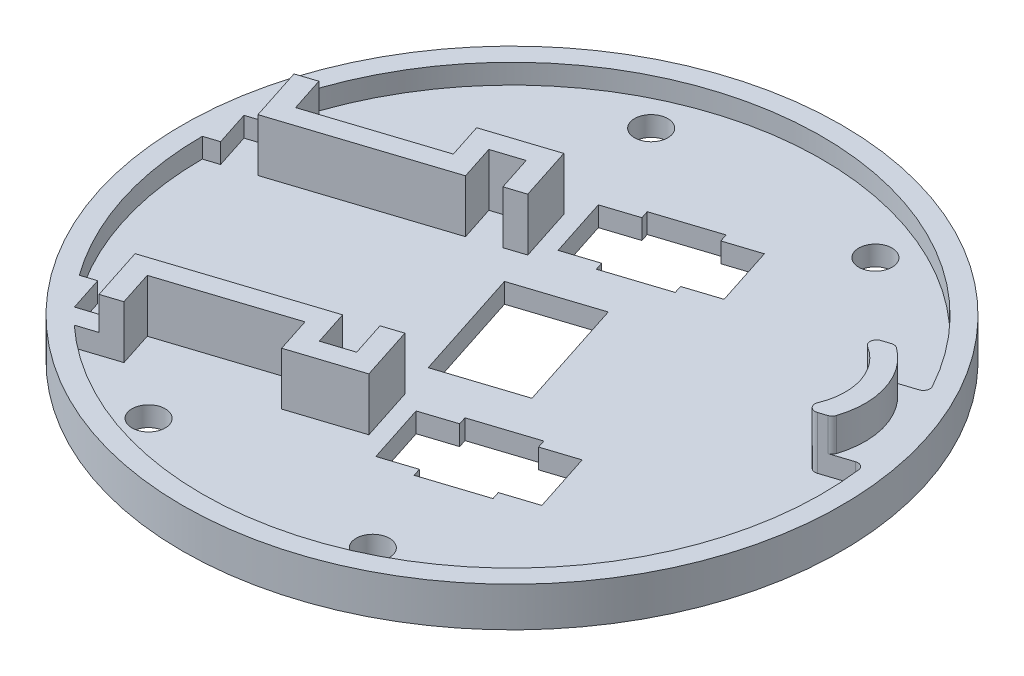
from build123d import *

# Parameters (mm, degrees)
A_BASE_T_START                 = -1.5
A_BASE_T_OUTLINE_R             = 47
A_BASE_T_OUTLINE_R_2           = 1
A_BASE_T_DEPTH                 = 3
OUTER_RING_DEPTH               = 3
OUTER_RING_DEPTH_BACK          = 3
SKETCH1_R                      = 50
SKETCH1_R_2                    = 47.000000000000014
SERVO_FRAME_DEPTH              = 3
PATCHING_START                 = -3
SKETCH4_R                      = 1.000000000000005
SKETCH4_R_2                    = 0.9999999999999875
SKETCH4_R_3                    = 1.0000000000000018
PATCHING_DEPTH                 = 3
BOTTOM_HOLES_DEPTH             = 71.77428911688199
SERVO_FRAME_EXTENSION_DEPTH    = 5
F_8_0_199_DIAMETER_HOLE1_D     = 5.0546
F_8_0_199_DIAMETER_HOLE1_DEPTH = 10
F_8_0_199_DIAMETER_HOLE1_TIP   = 1.5185550424683532
SHELL_TAB_DEPTH                = 3
SHELL_TAB_EXTENSION_DEPTH      = 5
CONTOURING_R                   = 1


# Read off the part's stored shape, not the designer's step: a_base_t
with BuildPart() as part:
    # a_base_t outline → a_base_t (new body)
    with BuildSketch(Plane(origin=(0, 0, 0), x_dir=(1, 0, 0), z_dir=(0, 1, 0)).offset(A_BASE_T_START)):
        Circle(A_BASE_T_OUTLINE_R)
        with Locations((-17.009259258, -38.128042167)):
            Circle(A_BASE_T_OUTLINE_R_2, mode=Mode.SUBTRACT)
        with Locations((-9.166666665, -28.284271247)):
            Circle(A_BASE_T_OUTLINE_R_2, mode=Mode.SUBTRACT)
        with Locations((17.009259258, -38.128042167)):
            Circle(A_BASE_T_OUTLINE_R_2, mode=Mode.SUBTRACT)
        with Locations((27.5, -28.284271247)):
            Circle(A_BASE_T_OUTLINE_R_2, mode=Mode.SUBTRACT)
        with Locations((-27.5, 28.284271247)):
            Circle(A_BASE_T_OUTLINE_R_2, mode=Mode.SUBTRACT)
        with Locations((-17.009259258, 38.128042167)):
            Circle(A_BASE_T_OUTLINE_R_2, mode=Mode.SUBTRACT)
        with Locations((9.166666665, 28.284271247)):
            Circle(A_BASE_T_OUTLINE_R_2, mode=Mode.SUBTRACT)
        with Locations((17.009259258, 38.128042167)):
            Circle(A_BASE_T_OUTLINE_R_2, mode=Mode.SUBTRACT)
    extrude(amount=A_BASE_T_DEPTH)

    # Sketch1 → Outer Ring (add, two sides: drawn at the far end of the back side and taken through both)
    with BuildSketch(Plane(origin=(0, 1.5, 0), x_dir=(1, 0, 0), z_dir=(0, 1, 0)).offset(-OUTER_RING_DEPTH_BACK)):
        with Locations(Location((0, 0, 0), (0, 0, 270))):
            Circle(SKETCH1_R)
        with Locations(Location((0, 0, 0), (0, 0, 270))):
            Circle(SKETCH1_R_2, mode=Mode.SUBTRACT)
    extrude(amount=OUTER_RING_DEPTH + OUTER_RING_DEPTH_BACK)

    # Sketch2 → Servo Frame (add)
    with BuildSketch(Plane(origin=(0, 1.5, 0), x_dir=(1, 0, 0), z_dir=(0, 1, 0))):
        with BuildLine():
            Line((-38.0591968031926, -27.57711984047382), (-35.959340758040334, -26.89657621793413))
            Line((-35.959340758040334, -26.89657621793413), (-34.26367139752046, -32.128660450798996))
            Line((-34.26367139752046, -32.128660450798996), (-29.982875206994592, -30.74129461037364))
            Line((-29.982875206994592, -30.74129461037364), (-31.678544567514475, -25.509210377508683))
            Line((-31.678544567514475, -25.509210377508683), (-7.896343509037404, -17.801622375145534))
            Line((-7.896343509037404, -17.801622375145534), (-6.200674148517496, -23.033706608010526))
            Line((-6.200674148517496, -23.033706608010526), (-1.9198779579916272, -21.64634076758515))
            Line((-1.9198779579916272, -21.64634076758515), (-3.6155473185115334, -16.414256534720167))
            Line((-3.6155473185115334, -16.414256534720167), (-0.7616831914942761, -15.489345974436619))
            Line((-0.7616831914942761, -15.489345974436619), (1.8588967293091871, -23.57529433431882))
            Line((1.8588967293091871, -23.57529433431882), (-8.1296277152512, -26.812481295311326))
            Line((-8.1296277152512, -26.812481295311326), (-9.825297075771067, -21.580397062446362))
            Line((-9.825297075771067, -21.580397062446362), (-27.89976988021365, -27.438163944242362))
            Line((-27.89976988021365, -27.438163944242362), (-26.20410051969376, -32.670248177107304))
            Line((-26.20410051969376, -32.670248177107304), (-31.900225974204588, -34.516308939321476))
            ThreePointArc((-31.900225974204588, -34.516308939321476), (-35.15136263609195, -31.199065768480295), (-38.0591968031926, -27.57711984047382))
        make_face()
        with BuildLine():
            Line((-12.323065195039092, 20.183955613279007), (-22.311589639599458, 16.946768652286423))
            Line((-22.311589639599458, 16.946768652286423), (-20.615920279079525, 11.714684419421493))
            Line((-20.615920279079525, 11.714684419421493), (-38.690393083522096, 5.856917537625489))
            Line((-38.690393083522096, 5.856917537625489), (-40.38606244404183, 11.089001770490507))
            Line((-40.38606244404183, 11.089001770490507), (-46.08218789855281, 9.242941008276162))
            ThreePointArc((-46.08218789855281, 9.242941008276162), (-46.769478259318326, 4.649290628811158), (-46.999998885933856, 0.01023338735953519))
            Line((-46.999998885933856, 0.01023338735953519), (-44.90014284078164, 0.6907770098992967))
            Line((-44.90014284078164, 0.6907770098992967), (-46.595812201301534, 5.922861242764241))
            Line((-46.595812201301534, 5.922861242764241), (-42.31501601077568, 7.31022708318961))
            Line((-42.31501601077568, 7.31022708318961), (-40.61934665025577, 2.0781428503246593))
            Line((-40.61934665025577, 2.0781428503246593), (-16.8371455917787, 9.785730852687836))
            Line((-16.8371455917787, 9.785730852687836), (-18.53281495229861, 15.017815085552826))
            Line((-18.53281495229861, 15.017815085552826), (-14.252018761772744, 16.405180925978193))
            Line((-14.252018761772744, 16.405180925978193), (-12.556349401252827, 11.173096693113212))
            Line((-12.556349401252827, 11.173096693113212), (-9.702485274235583, 12.09800725339679))
            Line((-9.702485274235583, 12.09800725339679), (-12.323065195039092, 20.183955613279007))
        make_face()
    extrude(amount=SERVO_FRAME_DEPTH)

    # Sketch4 → Patching (add)
    with BuildSketch(Plane(origin=(0, 1.5, 0), x_dir=(1, 0, 0), z_dir=(0, 1, 0)).offset(PATCHING_START)):
        with Locations((-9.166666664999994, -28.284271247461895)):
            Circle(SKETCH4_R)
        with Locations((27.499999999999897, -28.284271247461895)):
            Circle(SKETCH4_R_2)
        with Locations((-27.499999999999897, 28.284271247461895)):
            Circle(SKETCH4_R_3)
        with Locations((9.166666664999994, 28.284271247461895)):
            Circle(SKETCH4_R)
    extrude(amount=PATCHING_DEPTH)

    # Sketch3 → Bottom Holes (cut, through all)
    with BuildSketch(Plane(origin=(0, 1.5, 0), x_dir=(1, 0, 0), z_dir=(0, 1, 0))):
        Polygon((-2.4573525520141377, -10.257261741571627), (-8.006815913715702, 6.865923020531821), (3.8842846155226813, 10.719717021713405), (9.43374797722423, -6.403467740390065), align=None)
        Polygon((11.007812758181103, 21.175234550786502), (8.078929317282705, 30.212470953007827), (3.084667095002796, 28.593877472511632), (2.6992876948846334, 29.78298752543549), (-6.337948707336641, 26.854104084537454), (-5.952569307218477, 25.6649940316136), (-10.9468315294987, 24.046400551117266), (-8.017948088600651, 15.009164148896), (-3.023685866320578, 16.62775762939225), (-2.6383064662022653, 15.438647576468425), (6.398929936019005, 18.36753101736646), (6.01355053590084, 19.55664107029031), align=None)
        Polygon((19.270601899965627, -21.348744750290177), (19.65598130008379, -22.53785480321403), (10.618744897862516, -25.46673824411206), (10.233365497744353, -24.27762819118821), (5.239103275464198, -25.89622167168446), (2.3102198345661495, -16.85898526946319), (7.304482056846301, -15.240391788966894), (6.9191026567281435, -14.051281736043038), (15.95633905894941, -11.122398295145004), (16.34171845906757, -12.31150834806886), (21.335980681347763, -10.692914867572457), (24.2648641222456, -19.7301512697939), align=None)
    extrude(amount=-BOTTOM_HOLES_DEPTH, mode=Mode.SUBTRACT)

    # Sketch8 → Servo Frame Extension (add)
    with BuildSketch(Plane(origin=(0, 4.500000000000001, 0), x_dir=(1, 0, 0), z_dir=(0, 1, 0))):
        Polygon((1.8588967293091865, -23.57529433431882), (-0.7616831914942761, -15.489345974436619), (-3.6155473185115334, -16.414256534720167), (-1.9198779579916272, -21.64634076758515), (-6.200674148517496, -23.033706608010526), (-7.896343509037404, -17.801622375145534), (-31.678544567514475, -25.509210377508683), (-29.982875206994592, -30.74129461037364), (-29.057964646711014, -33.59515873739088), (-26.20410051969376, -32.670248177107304), (-27.89976988021365, -27.438163944242362), (-9.825297075771067, -21.580397062446362), (-8.1296277152512, -26.812481295311326), align=None)
        Polygon((-40.38606244404183, 11.089001770490507), (-43.23992657105916, 10.164091210206845), (-42.31501601077568, 7.31022708318961), (-40.61934665025577, 2.0781428503246593), (-16.837145591778697, 9.785730852687836), (-18.53281495229861, 15.017815085552826), (-14.252018761772744, 16.405180925978193), (-12.556349401252827, 11.173096693113212), (-9.702485274235583, 12.09800725339679), (-12.323065195039092, 20.183955613279007), (-22.311589639599458, 16.946768652286423), (-20.615920279079525, 11.714684419421493), (-38.690393083522096, 5.856917537625489), align=None)
    extrude(amount=SERVO_FRAME_EXTENSION_DEPTH)

    # #8 (0.199) Diameter Hole1
    with Locations(Plane(origin=(0, 1.5, 0), x_dir=(1, 0, 0), z_dir=(0, 1, 0))):
        with Locations((17.009259258, -38.128042167), (17.009259258, 38.128042167), (-17.009259258, 38.128042167), (-17.009259258, -38.128042167)):
            Hole(F_8_0_199_DIAMETER_HOLE1_D / 2, depth=F_8_0_199_DIAMETER_HOLE1_DEPTH)
            with Locations((0, 0, -(F_8_0_199_DIAMETER_HOLE1_DEPTH + F_8_0_199_DIAMETER_HOLE1_TIP / 2))):  # 118° drill point
                Cone(0, F_8_0_199_DIAMETER_HOLE1_D / 2, F_8_0_199_DIAMETER_HOLE1_TIP, mode=Mode.SUBTRACT)

    # Sketch21 → Shell Tab (add)
    with BuildSketch(Plane(origin=(0, 1.5, 0), x_dir=(1, 0, 0), z_dir=(0, 1, 0))):
        with BuildLine():
            Line((38.43738005388435, 4.573146492125436), (46.4498888135124, 7.169925328225916))
            ThreePointArc((46.4498888135124, 7.169925328225916), (44.71053798993682, 14.490265444442931), (41.825336012094446, 21.439245963312132))
            Line((41.825336012094446, 21.439245963312132), (33.81282725246639, 18.842467127211638))
            ThreePointArc((33.81282725246639, 18.842467127211638), (39.954097778241405, 12.948747843970278), (38.43738005388435, 4.573146492125436))
        make_face()
    extrude(amount=SHELL_TAB_DEPTH)

    # Sketch22 → Shell Tab Extension (add)
    with BuildSketch(Plane(origin=(0, 4.500000000000001, 0), x_dir=(1, 0, 0), z_dir=(0, 1, 0))):
        with BuildLine():
            Line((38.43738005388435, 4.573146492125436), (42.61596967836049, 5.927388144410685))
            ThreePointArc((42.61596967836049, 5.927388144410685), (42.80796190525865, 13.873658404253868), (37.99141687694254, 20.19670877949689))
            Line((37.99141687694254, 20.19670877949689), (33.81282725246639, 18.842467127211638))
            ThreePointArc((33.81282725246639, 18.842467127211638), (39.954097778241405, 12.948747843970278), (38.43738005388435, 4.573146492125436))
        make_face()
    extrude(amount=SHELL_TAB_EXTENSION_DEPTH)

    # Contouring
    contouring_edges = [part.edges().sort_by_distance(p)[0] for p in [
        (33.81282725246639, 5.5, -18.84246712721164),
        (38.43738005388435, 5.5, -4.573146492125435),
        (46.44988881351241, 3, -7.169925328225917),
        (41.82533601209445, 3, -21.439245963312132),
        (42.61596967836049, 7.000000000000001, -5.927388144410685),
        (37.99141687694254, 7.000000000000001, -20.19670877949689),
    ]]
    fillet(contouring_edges, radius=CONTOURING_R)


solid = part.part
